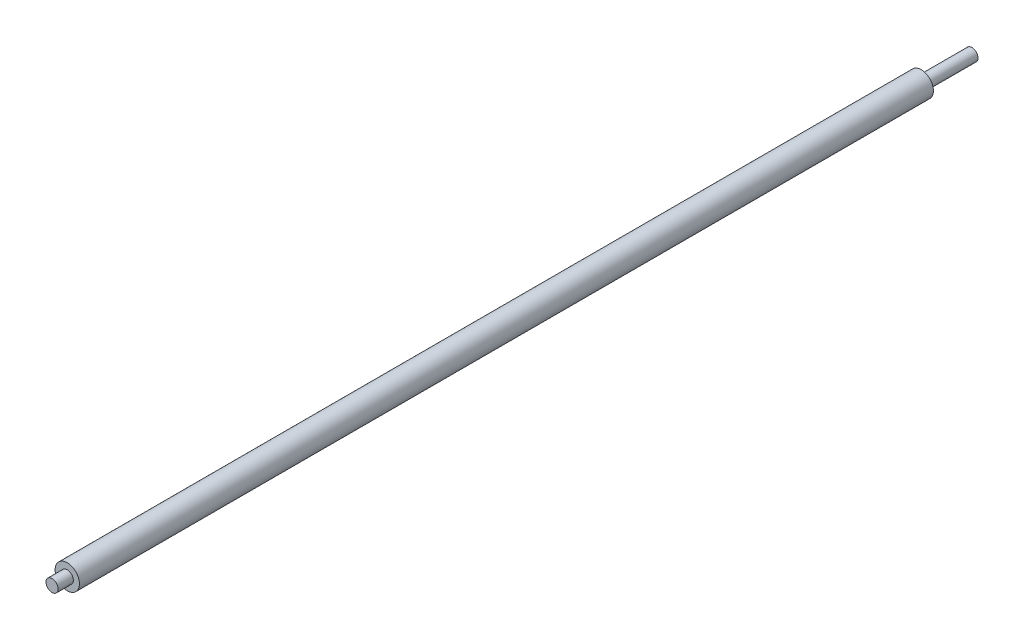
from build123d import *

# Parameters (mm, degrees)
SKETCH1_R           = 6
BOSS_EXTRUDE1_DEPTH = 210.75
SKETCH2_R           = 3
BOSS_EXTRUDE4_DEPTH = 7.5
BOSS_EXTRUDE5_START = 25
SKETCH3_R           = 3
BOSS_EXTRUDE5_DEPTH = 25


with BuildPart() as part:
    # Sketch1 → Boss-Extrude1 (new, symmetric)
    with BuildSketch(Plane.XY):
        Circle(SKETCH1_R)
    extrude(amount=BOSS_EXTRUDE1_DEPTH, both=True)

    # Sketch2 → Boss-Extrude4 (add)
    with BuildSketch(Plane.XY.offset(210.75)):
        Circle(SKETCH2_R)
    extrude(amount=BOSS_EXTRUDE4_DEPTH)

    # Sketch3 → Boss-Extrude5 (add)
    with BuildSketch(Plane(origin=(0, 0, -210.75), x_dir=(-1, 0, 0), z_dir=(0, 0, -1)).offset(BOSS_EXTRUDE5_START)):
        Circle(SKETCH3_R)
    extrude(amount=-BOSS_EXTRUDE5_DEPTH)


solid = part.part
